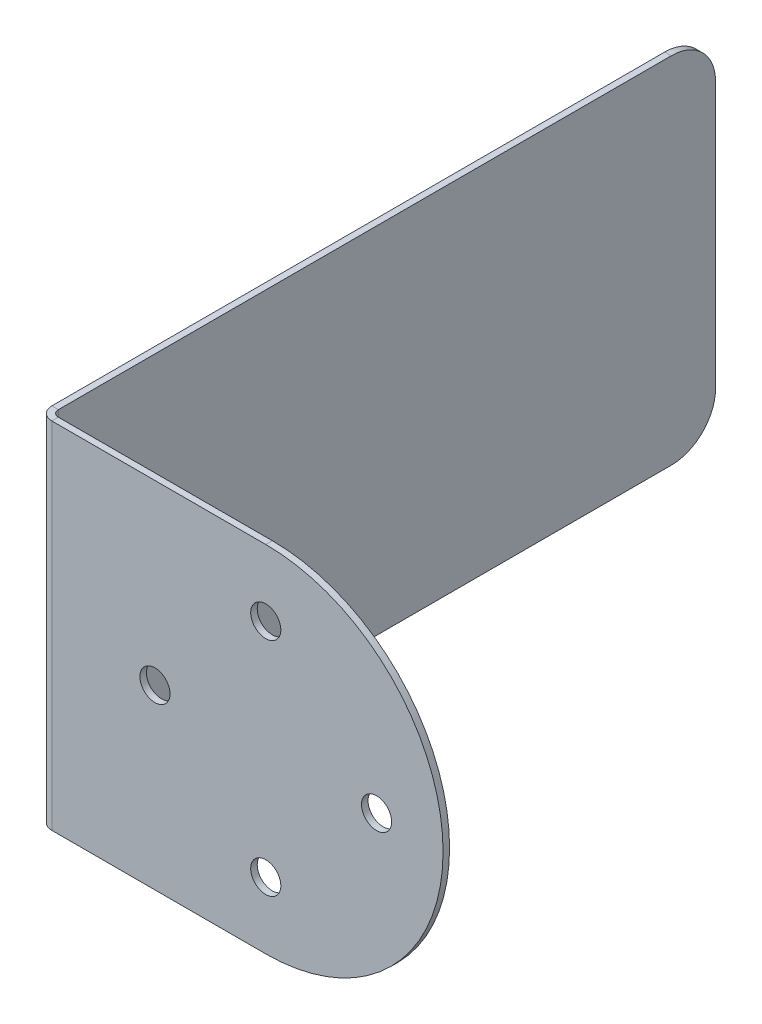
from build123d import *

# Parameters (mm, degrees)
BASE_FLANGE1_DEPTH       = 0.7366
SKETCHED_START           = -24.545942999
SKETCHED_BEND1_OUTLINE_W = 0.7366
SKETCHED_BEND1_OUTLINE_H = 40
SKETCHED_BEND1_DEPTH     = 45.545942999
SKETCHED_START_2         = -25.131186431
SKETCHED_BEND1_2_DEPTH   = 0.004036568
SKETCHED_START_3         = -25.867786431
SKETCHED_BEND1_3_DEPTH   = 1.4732
SKETCHED_START_4         = -20
SKETCHED_BEND1_4_DEPTH   = 40
M3_CLEARANCE_HOLE1_D     = 3.4
M3_CLEARANCE_HOLE1_DEPTH = 0.7366
M3_CLEARANCE_HOLE1_TIP   = 1.021463052


with BuildPart() as part:
    # Base-Flange1: sheet metal written as solids
    # Sketch1 → Base-Flange1 (new body)
    with BuildSketch(Plane.YZ):
        with BuildLine():
            Line((-20, 0), (-20, -95))
            ThreePointArc((-20, -95), (-18.535533906, -98.535533906), (-15, -100))
            Line((-15, -100), (15, -100))
            ThreePointArc((15, -100), (18.535533906, -98.535533906), (20, -95))
            Line((20, -95), (20, 0))
            ThreePointArc((20, 0), (0, 20), (-20, 0))
        make_face()
    extrude(amount=-BASE_FLANGE1_DEPTH)

    # Sketched Bend1: read off the stored shape, not the designer's step
    # Sketched Bend1 outline → Sketched Bend1 (cut)
    with BuildSketch(Plane.XY.offset(SKETCHED_START)):
        with Locations((-0.3683, 0)):
            Rectangle(SKETCHED_BEND1_OUTLINE_W, SKETCHED_BEND1_OUTLINE_H)
    extrude(amount=SKETCHED_BEND1_DEPTH, mode=Mode.SUBTRACT)

    # Sketched Bend1 2 outline → Sketched Bend1 2 (add)
    with BuildSketch(Plane.XY.offset(SKETCHED_START_2)):
        with BuildLine():
            ThreePointArc((24.868813569, -20), (44.868813569, 0), (24.868813569, 20))
            Line((24.868813569, 20), (0, 20))
            Line((0, 20), (0, -20))
            Line((0, -20), (24.868813569, -20))
        make_face()
    extrude(amount=SKETCHED_BEND1_2_DEPTH)

    # Sketched Bend1 3 outline → Sketched Bend1 3 (add)
    with BuildSketch(Plane.XY.offset(SKETCHED_START_3)):
        with BuildLine():
            ThreePointArc((24.868813569, -20), (44.868813569, 0), (24.868813569, 20))
            Line((24.868813569, 20), (0, 20))
            Line((0, 20), (0, -20))
            Line((0, -20), (24.868813569, -20))
        make_face()
    extrude(amount=SKETCHED_BEND1_3_DEPTH)

    # Sketched Bend1 4 outline → Sketched Bend1 4 (cut)
    with BuildSketch(Plane(origin=(0, 0, 0), x_dir=(1, 0, 0), z_dir=(0, 1, 0)).offset(SKETCHED_START_4)):
        with BuildLine():
            ThreePointArc((0, 25.867786431), (0.215745145, 25.346931576), (0.7366, 25.131186431))
            Line((0.7366, 25.131186431), (46, 25.131186431))
            Line((46, 25.131186431), (46, 25.867786431))
            Line((46, 25.867786431), (0, 25.867786431))
        make_face()
        with BuildLine():
            Line((46, 23), (46, 24.394586426))
            Line((46, 24.394586426), (0.7366, 24.394586431))
            ThreePointArc((0.7366, 24.394586431), (-0.30510971, 24.826076721), (-0.7366, 25.867786431))
            Line((-0.7366, 25.867786431), (-0.7366, 27))
            Line((-0.7366, 27), (-2, 27))
            Line((-2, 27), (-2, 24.545942999))
            Line((-2, 24.545942999), (0, 24.545942999))
            Line((0, 24.545942999), (0, 23))
            Line((0, 23), (46, 23))
        make_face()
    extrude(amount=SKETCHED_BEND1_4_DEPTH, mode=Mode.SUBTRACT)

    # M3 Clearance Hole1
    with Locations(Plane(origin=(0, 0, -24.394586431), x_dir=(0, -1, 0), z_dir=(0, 0, 1))):
        with Locations((0, 37.368813569), (-12.5, 24.868813569), (0, 12.368813569), (12.5, 24.868813569)):
            Hole(M3_CLEARANCE_HOLE1_D / 2, depth=M3_CLEARANCE_HOLE1_DEPTH)
            with Locations((0, 0, -(M3_CLEARANCE_HOLE1_DEPTH + M3_CLEARANCE_HOLE1_TIP / 2))):  # 118° drill point
                Cone(0, M3_CLEARANCE_HOLE1_D / 2, M3_CLEARANCE_HOLE1_TIP, mode=Mode.SUBTRACT)


solid = part.part
